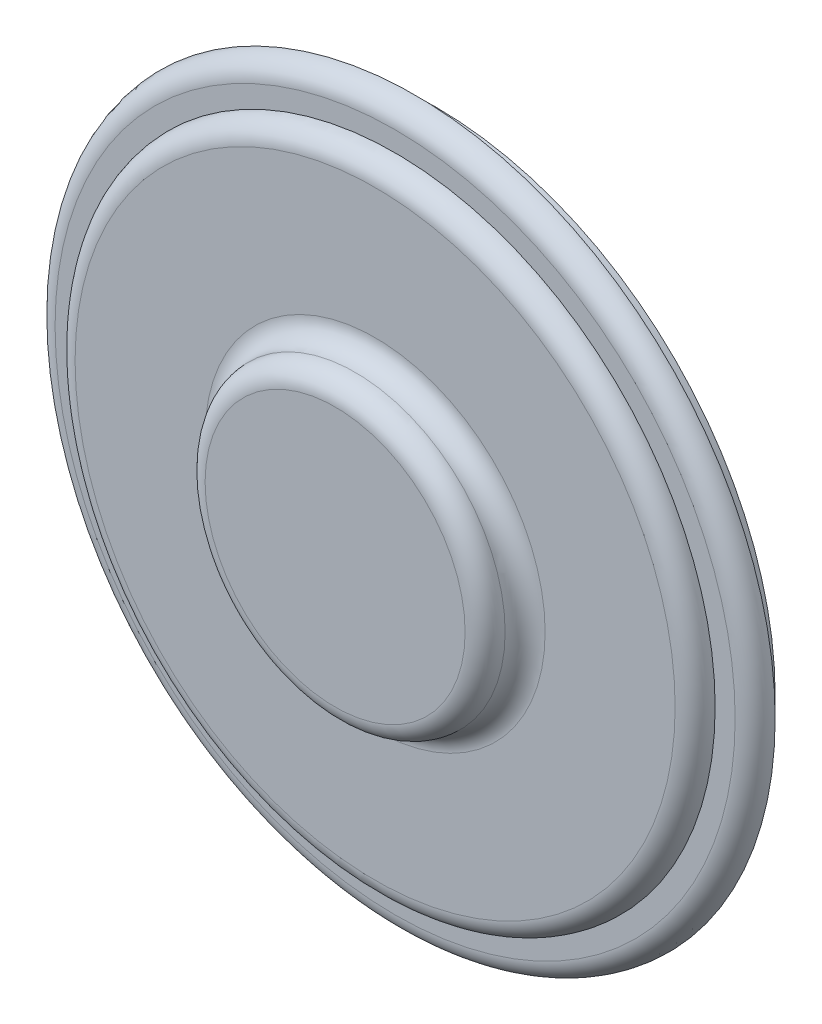
from build123d import *

# Parameters (mm, degrees)
SKETCH1_R           = 18
BOSS_EXTRUDE1_DEPTH = 2
SKETCH2_R           = 16
BOSS_EXTRUDE2_DEPTH = 1
SKETCH3_R           = 7.5
BOSS_EXTRUDE3_DEPTH = 2
FILLET2_R           = 1
SKETCH4_R           = 18
SKETCH4_R_2         = 17
CUT_EXTRUDE1_DEPTH  = 1
SKETCH5_R           = 15.789460751
SKETCH5_R_2         = 13.932235083
CUT_EXTRUDE2_DEPTH  = 1
SKETCH6_R           = 12.231632463
SKETCH6_R_2         = 3.890953776
CUT_EXTRUDE3_DEPTH  = 1
FILLET3_R           = 1
CHAMFER1_SIZE       = 7.115369722
CHAMFER1_SIZE_2     = 1


# Some blends are built 0.0001 mm under size
with BuildPart() as part:
    # Sketch1 → Boss-Extrude1 (new body)
    with BuildSketch(Plane.XY):
        Circle(SKETCH1_R)
    extrude(amount=BOSS_EXTRUDE1_DEPTH)

    # Sketch2 → Boss-Extrude2 (add)
    with BuildSketch(Plane.XY.offset(2)):
        Circle(SKETCH2_R)
    extrude(amount=BOSS_EXTRUDE2_DEPTH)

    # Sketch3 → Boss-Extrude3 (add)
    with BuildSketch(Plane.XY.offset(3)):
        Circle(SKETCH3_R)
    extrude(amount=BOSS_EXTRUDE3_DEPTH)

    # Fillet2
    fillet2_edges = [part.edges().sort_by_distance(p)[0] for p in [
        (-7.5, 0, 3),
        (-7.5, 0, 5),
        (-18, 0, 2),
        (-16, 0, 3),
    ]]
    fillet(fillet2_edges, radius=FILLET2_R - 0.0001)  # a hair under: the kernel refuses the full size

    # Sketch4 → Cut-Extrude1 (cut)
    with BuildSketch(Plane(origin=(0, 0, 0), x_dir=(-1, 0, 0), z_dir=(0, 0, -1))):
        Circle(SKETCH4_R)
        Circle(SKETCH4_R_2, mode=Mode.SUBTRACT)
    extrude(amount=-CUT_EXTRUDE1_DEPTH, mode=Mode.SUBTRACT)

    # Sketch5 → Cut-Extrude2 (cut)
    with BuildSketch(Plane(origin=(0, 0, 0), x_dir=(-1, 0, 0), z_dir=(0, 0, -1))):
        Circle(SKETCH5_R)
        Circle(SKETCH5_R_2, mode=Mode.SUBTRACT)
    extrude(amount=-CUT_EXTRUDE2_DEPTH, mode=Mode.SUBTRACT)

    # Sketch6 → Cut-Extrude3 (cut)
    with BuildSketch(Plane(origin=(0, 0, 0), x_dir=(-1, 0, 0), z_dir=(0, 0, -1))):
        Circle(SKETCH6_R)
        Circle(SKETCH6_R_2, mode=Mode.SUBTRACT)
    extrude(amount=-CUT_EXTRUDE3_DEPTH, mode=Mode.SUBTRACT)

    # Fillet3
    fillet3_edges = [part.edges().sort_by_distance(p)[0] for p in [
        (3.890953776, 0, 0),
    ]]
    fillet(fillet3_edges, radius=FILLET3_R - 0.0001)  # a hair under: the kernel refuses the full size

    # Chamfer1
    # the kernel refuses this chamfer: 7.115369722, 1 mm, written as the material it adds along each edge
    with BuildSketch(Plane(origin=(0, 0, 1), x_dir=(-1, 0, 0), z_dir=(0, -1, 0))) as chamfer1_piece_1_section:
        Polygon((12.231632463 - CHAMFER1_SIZE, 0), (12.231632463, CHAMFER1_SIZE_2), (12.231632463, 0), align=None)
    chamfer1_piece_1 = revolve(axis=Axis((0, 0, 1), (0, 0, -1)), mode=Mode.PRIVATE)
    chamfer1_piece_1 = split(chamfer1_piece_1, bisect_by=Plane(origin=(8.54226682, 0, 0), z_dir=(0, 0, 1)), keep=Keep.TOP, mode=Mode.PRIVATE)
    add(chamfer1_piece_1)


solid = part.part
